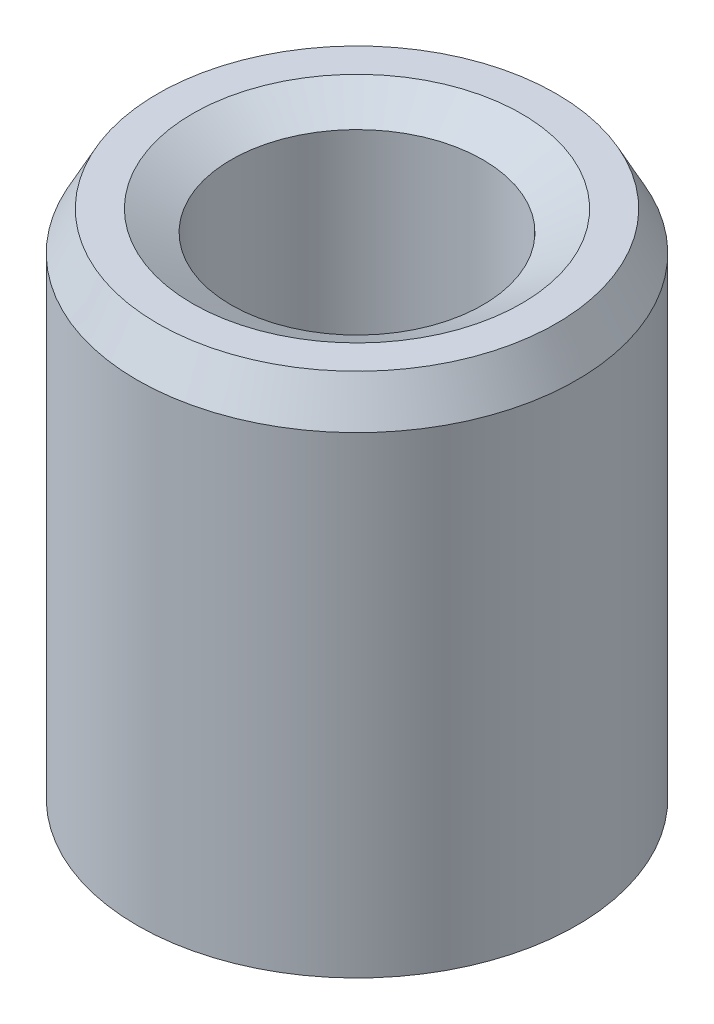
from build123d import *
from OCP.BRepFilletAPI import BRepFilletAPI_MakeChamfer

# Parameters (mm, degrees)
SKETCH1_R           = 17.5
BOSS_EXTRUDE1_DEPTH = 42.325151872
SKETCH2_R           = 10.023084689
CUT_EXTRUDE1_DEPTH  = 50.029771374
CHAMFER1_SIZE       = 3.078064126
CHAMFER1_SIZE2      = 1.634855005


with BuildPart() as part:
    # Sketch1 → Boss-Extrude1 (new body)
    with BuildSketch(Plane(origin=(0, 0, 0), x_dir=(1, 0, 0), z_dir=(0, 1, 0))):
        Circle(SKETCH1_R)
    extrude(amount=BOSS_EXTRUDE1_DEPTH)

    # Sketch2 → Cut-Extrude1 (cut, through all)
    with BuildSketch(Plane(origin=(0, 0, 0), x_dir=(1, 0, 0), z_dir=(0, 1, 0))):
        Circle(SKETCH2_R)
    extrude(amount=CUT_EXTRUDE1_DEPTH, mode=Mode.SUBTRACT)

    # Chamfer1: one chamfer whose edges measure the first distance from different faces: ONE call of the kernel's chamfer builder (chamfer() names one face for all edges)
    chamfer1_edges_1 = [part.edges().sort_by_distance(p)[0] for p in [
        (-10.023084689, 42.325151872, 0),
    ]]
    chamfer1_side_1 = [part.faces().sort_by_distance(p)[0] for p in [
        (-17.005025253, 42.325151872, 0),
    ]]
    chamfer1_edges_2 = [part.edges().sort_by_distance(p)[0] for p in [
        (-10.023084689, 0, 0),
    ]]
    chamfer1_side_2 = [part.faces().sort_by_distance(p)[0] for p in [
        (-10.023084689, 21.162575936, 0),
    ]]
    chamfer1_edges_3 = [part.edges().sort_by_distance(p)[0] for p in [
        (-17.5, 0, 0),
    ]]
    chamfer1_side_3 = [part.faces().sort_by_distance(p)[0] for p in [
        (-17.005025253, 0, 0),
    ]]
    chamfer1_edges_4 = [part.edges().sort_by_distance(p)[0] for p in [
        (-17.5, 42.325151872, 0),
    ]]
    chamfer1_side_4 = [part.faces().sort_by_distance(p)[0] for p in [
        (-17.5, 21.162575936, 0),
    ]]
    chamfer1 = BRepFilletAPI_MakeChamfer(part.part.solid().wrapped)
    for e in chamfer1_edges_1:
        chamfer1.Add(CHAMFER1_SIZE, CHAMFER1_SIZE2, e.wrapped, chamfer1_side_1[0].wrapped)  # the first distance lies on this face
    for e in chamfer1_edges_2:
        chamfer1.Add(CHAMFER1_SIZE, CHAMFER1_SIZE2, e.wrapped, chamfer1_side_2[0].wrapped)  # the first distance lies on this face
    for e in chamfer1_edges_3:
        chamfer1.Add(CHAMFER1_SIZE, CHAMFER1_SIZE2, e.wrapped, chamfer1_side_3[0].wrapped)  # the first distance lies on this face
    for e in chamfer1_edges_4:
        chamfer1.Add(CHAMFER1_SIZE, CHAMFER1_SIZE2, e.wrapped, chamfer1_side_4[0].wrapped)  # the first distance lies on this face
    add(Compound.cast(chamfer1.Shape()), mode=Mode.REPLACE)


solid = part.part
